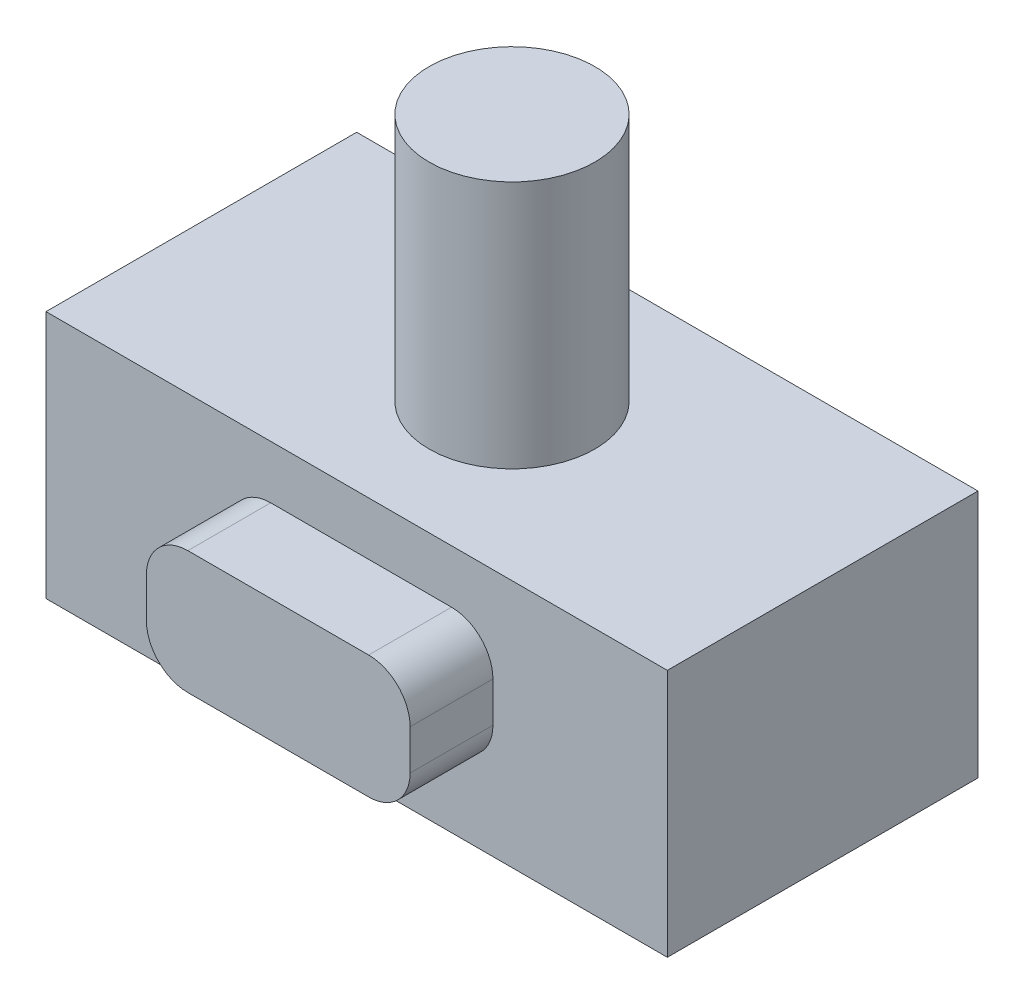
from build123d import *

# Parameters (mm, degrees)
SKETCH1_W           = 150
SKETCH1_H           = 75
BOSS_EXTRUDE1_DEPTH = 60
SKETCH2_R           = 20
BOSS_EXTRUDE2_DEPTH = 60
BOSS_EXTRUDE3_DEPTH = 20


with BuildPart() as part:
    # Sketch1 → Boss-Extrude1 (new body)
    with BuildSketch(Plane(origin=(0, 0, 0), x_dir=(1, 0, 0), z_dir=(0, 1, 0))):
        Rectangle(SKETCH1_W, SKETCH1_H)
    extrude(amount=BOSS_EXTRUDE1_DEPTH)

    # Sketch2 → Boss-Extrude2 (add)
    with BuildSketch(Plane(origin=(0, 60, 0), x_dir=(1, 0, 0), z_dir=(0, 1, 0))):
        Circle(SKETCH2_R)
    extrude(amount=BOSS_EXTRUDE2_DEPTH)

    # Sketch3 → Boss-Extrude3 (add)
    with BuildSketch(Plane.XY.offset(37.5)):
        with BuildLine():
            Line((-20.750294914, 47.150331809), (22.895664326, 47.150331809))
            ThreePointArc((22.895664326, 47.150331809), (29.966732138, 44.221399621), (32.895664326, 37.150331809))
            Line((32.895664326, 37.150331809), (32.895664326, 27.472721601))
            ThreePointArc((32.895664326, 27.472721601), (29.966732138, 20.401653789), (22.895664326, 17.472721601))
            Line((22.895664326, 17.472721601), (-20.750294914, 17.472721601))
            ThreePointArc((-20.750294914, 17.472721601), (-27.821362726, 20.401653789), (-30.750294914, 27.472721601))
            Line((-30.750294914, 27.472721601), (-30.750294914, 37.150331809))
            ThreePointArc((-30.750294914, 37.150331809), (-27.821362726, 44.221399621), (-20.750294914, 47.150331809))
        make_face()
    extrude(amount=BOSS_EXTRUDE3_DEPTH)


solid = part.part
